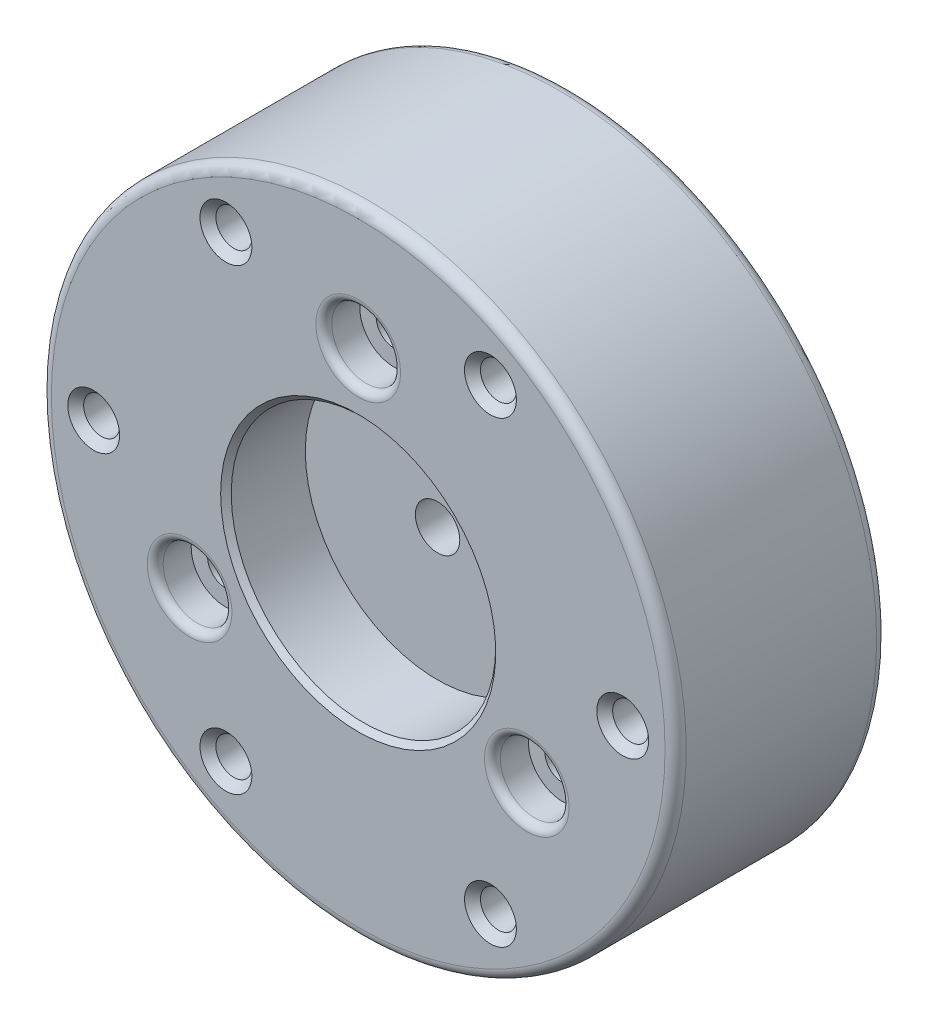
from build123d import *

# Parameters (mm, degrees)
STIRNSENKUNG_F_R_M3_ZYLINDERSCHRAUBE_MIT_D           = 3.4
STIRNSENKUNG_F_R_M3_ZYLINDERSCHRAUBE_MIT_CBORE_D     = 6.5
STIRNSENKUNG_F_R_M3_ZYLINDERSCHRAUBE_MIT_CBORE_DEPTH = 3.4
VERRUNDUNG1_R                                        = 0.75
FASE1_SIZE                                           = 0.75
KREISMUSTER1_COUNT                                   = 3
VERRUNDUNG1_OF_KREISMUSTER1_R                        = 0.75
FASE1_OF_KREISMUSTER1_SIZE                           = 0.75
STIRNSENKUNG_F_R_M3_ZYLINDERSCHRAUBE_2_D             = 3.4
STIRNSENKUNG_F_R_M3_ZYLINDERSCHRAUBE_2_CBORE_D       = 6.5
STIRNSENKUNG_F_R_M3_ZYLINDERSCHRAUBE_2_CBORE_DEPTH   = 3.4
VERRUNDUNG2_R                                        = 0.75
FASE2_SIZE                                           = 0.75
KREISMUSTER2_COUNT                                   = 6
VERRUNDUNG2_OF_KREISMUSTER2_R                        = 0.75
FASE2_OF_KREISMUSTER2_SIZE                           = 0.75
SKIZZE9_R                                            = 3.375
SCHNITT_LINEAR_AUSTRAGEN2_DEPTH                      = 7.5
FASE3_SIZE                                           = 0.5
FASE4_SIZE                                           = 1
VERRUNDUNG3_R                                        = 1
M5_GEWINDEBOHRUNG1_D                                 = 4.2


with BuildPart() as part:
    # Skizze1 → Rotation1 (revolve)
    with BuildSketch(Plane(origin=(0, 0, 0), x_dir=(1, 0, 0), z_dir=(0, 1, 0)), mode=Mode.PRIVATE) as rotation1_sk:
        Polygon((0, 0), (0, -12.5), (12.5, -12.5), (12.5, -20), (30, -20), (30, 0), align=None)
    revolve(rotation1_sk.sketch.rotate(Axis((0, 0, 0), (0, 0, 1)), 180), axis=Axis((0, 0, 0), (0, 0, 1)))

    # Stirnsenkung f_r M3 Zylinderschraube mit (through all)
    with Locations(Plane.XY.offset(20)):
        with Locations((0, 18.4)):
            stirnsenkung_f_r_m3_zylinderschraube_mit = CounterBoreHole(STIRNSENKUNG_F_R_M3_ZYLINDERSCHRAUBE_MIT_D / 2, STIRNSENKUNG_F_R_M3_ZYLINDERSCHRAUBE_MIT_CBORE_D / 2, STIRNSENKUNG_F_R_M3_ZYLINDERSCHRAUBE_MIT_CBORE_DEPTH)

    # Verrundung1
    verrundung1_edges = [part.edges().sort_by_distance(p)[0] for p in [
        (-3.25, 18.4, 20),
    ]]
    fillet(verrundung1_edges, radius=VERRUNDUNG1_R)

    # Fase1
    fase1_edges = [part.edges().sort_by_distance(p)[0] for p in [
        (1.7, 18.4, 0),
    ]]
    chamfer(fase1_edges, length=FASE1_SIZE)

    # Kreismuster1: Stirnsenkung f_r M3 Zylinderschraube mit ×3 about axis
    kreismuster1_axis = Axis((0, 0, 0), (0, 0, 1))
    for i in range(1, KREISMUSTER1_COUNT):
        add(stirnsenkung_f_r_m3_zylinderschraube_mit.rotate(kreismuster1_axis, i * 360 / KREISMUSTER1_COUNT), mode=Mode.SUBTRACT)

    # Verrundung1 of Kreismuster1
    verrundung1_of_kreismuster1_edges = [part.edges().sort_by_distance(p)[0] for p in [
        (-14.30986743, -12.014582562, 20),
        (17.55986743, -6.385417438, 20),
    ]]
    fillet(verrundung1_of_kreismuster1_edges, radius=VERRUNDUNG1_OF_KREISMUSTER1_R)

    # Fase1 of Kreismuster1
    fase1_of_kreismuster1_edges = [part.edges().sort_by_distance(p)[0] for p in [
        (-16.78486743, -7.727756814, 0),
        (15.08486743, -10.672243186, 0),
    ]]
    chamfer(fase1_of_kreismuster1_edges, length=FASE1_OF_KREISMUSTER1_SIZE)

    # Stirnsenkung f_r M3 Zylinderschraube 2 (through all)
    with Locations(Plane(origin=(0, 0, 0), x_dir=(-1, 0, 0), z_dir=(0, 0, -1))):
        with Locations((12.5, 21.650635095)):
            stirnsenkung_f_r_m3_zylinderschraube_2 = CounterBoreHole(STIRNSENKUNG_F_R_M3_ZYLINDERSCHRAUBE_2_D / 2, STIRNSENKUNG_F_R_M3_ZYLINDERSCHRAUBE_2_CBORE_D / 2, STIRNSENKUNG_F_R_M3_ZYLINDERSCHRAUBE_2_CBORE_DEPTH)

    # Verrundung2
    verrundung2_edges = [part.edges().sort_by_distance(p)[0] for p in [
        (-9.25, 21.650635095, 0),
    ]]
    fillet(verrundung2_edges, radius=VERRUNDUNG2_R)

    # Fase2
    fase2_edges = [part.edges().sort_by_distance(p)[0] for p in [
        (-14.2, 21.650635095, 20),
    ]]
    chamfer(fase2_edges, length=FASE2_SIZE)

    # Kreismuster2: Stirnsenkung f_r M3 Zylinderschraube 2 ×6 about axis
    kreismuster2_axis = Axis((0, 0, 0), (0, 0, 1))
    for i in range(1, KREISMUSTER2_COUNT):
        add(stirnsenkung_f_r_m3_zylinderschraube_2.rotate(kreismuster2_axis, i * 360 / KREISMUSTER2_COUNT), mode=Mode.SUBTRACT)

    # Verrundung2 of Kreismuster2
    verrundung2_of_kreismuster2_edges = [part.edges().sort_by_distance(p)[0] for p in [
        (-23.375, 2.814582562, 0),
        (-14.125, -18.836052533, 0),
        (9.25, -21.650635095, 0),
        (23.375, -2.814582562, 0),
        (14.125, 18.836052533, 0),
    ]]
    fillet(verrundung2_of_kreismuster2_edges, radius=VERRUNDUNG2_OF_KREISMUSTER2_R)

    # Fase2 of Kreismuster2
    fase2_of_kreismuster2_edges = [part.edges().sort_by_distance(p)[0] for p in [
        (-25.85, -1.472243186, 20),
        (-11.65, -23.122878281, 20),
        (14.2, -21.650635095, 20),
        (25.85, 1.472243186, 20),
        (11.65, 23.122878281, 20),
    ]]
    chamfer(fase2_of_kreismuster2_edges, length=FASE2_OF_KREISMUSTER2_SIZE)

    # Skizze9 → Schnitt-Linear austragen2 (cut)
    with BuildSketch(Plane(origin=(0, 0, 0), x_dir=(-1, 0, 0), z_dir=(0, 0, -1))):
        Circle(SKIZZE9_R)
    extrude(amount=-SCHNITT_LINEAR_AUSTRAGEN2_DEPTH, mode=Mode.SUBTRACT)

    # Fase3
    fase3_edges = [part.edges().sort_by_distance(p)[0] for p in [
        (12.5, 0, 20),
    ]]
    chamfer(fase3_edges, length=FASE3_SIZE)

    # Fase4
    fase4_edges = [part.edges().sort_by_distance(p)[0] for p in [
        (3.375, 0, 0),
    ]]
    chamfer(fase4_edges, length=FASE4_SIZE)

    # Verrundung3
    verrundung3_edges = [part.edges().sort_by_distance(p)[0] for p in [
        (30, 0, 0),
        (30, 0, 20),
    ]]
    fillet(verrundung3_edges, radius=VERRUNDUNG3_R - 0.0001)  # a hair under: the kernel refuses the full size

    # M5 Gewindebohrung1 (through all)
    with Locations(Plane.XY.offset(12.5)):
        with Locations((0, 0)):
            Hole(M5_GEWINDEBOHRUNG1_D / 2)


solid = part.part
